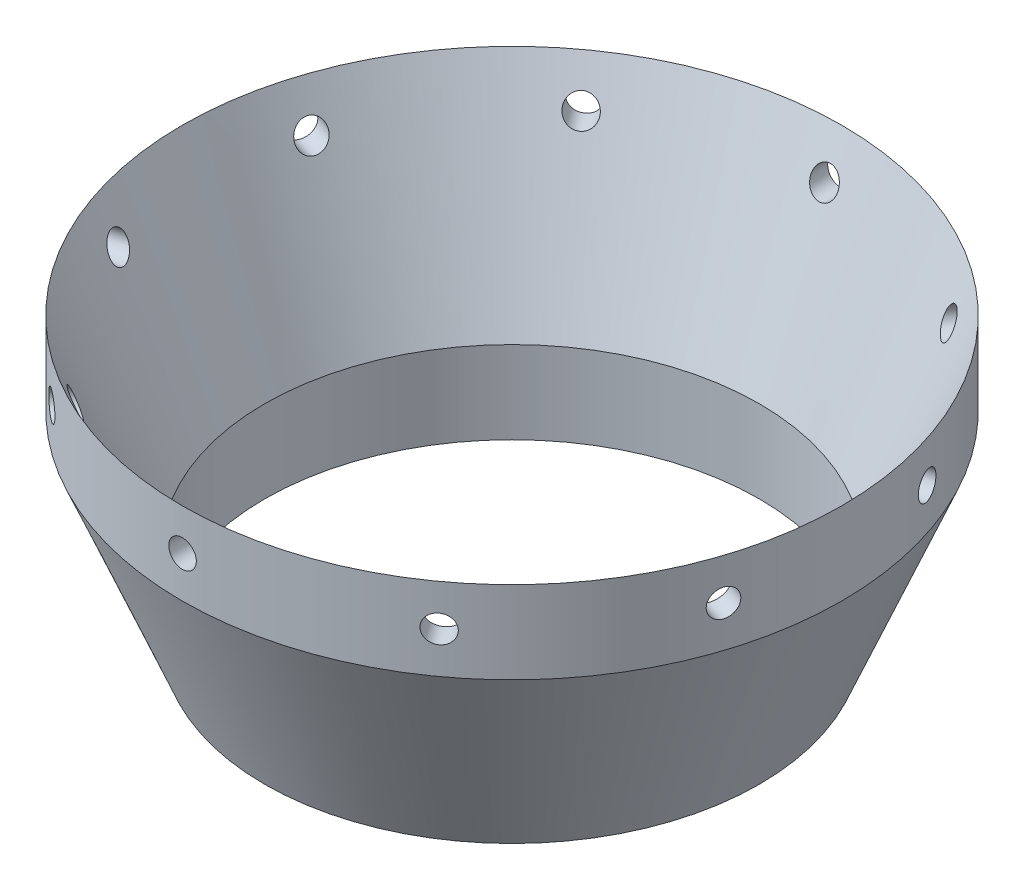
from build123d import *

# Parameters (mm, degrees)
SKETCH2_R          = 3.175
CUT_EXTRUDE1_DEPTH = 267.514272105
CIRPATTERN1_COUNT  = 10


with BuildPart() as part:
    # Sketch1 → Revolve1 (revolve)
    with BuildSketch(Plane.XY):
        Polygon((-57.15, 178.477978871), (-57.15, 197.527978871), (-76.2, 243.755978871), (-76.2, 224.705978871), align=None)
    revolve(axis=Axis((0, 0, 0), (0, 1, 0)))

    # Sketch2 → Cut-Extrude1 (cut, through all)
    with BuildSketch(Plane.XY):
        with Locations((0, 234.230978871)):
            Circle(SKETCH2_R)
    cut_extrude1 = extrude(amount=-CUT_EXTRUDE1_DEPTH, mode=Mode.SUBTRACT)

    # CirPattern1: Cut-Extrude1 ×10 about axis
    cirpattern1_axis = Axis((0, 235.80346447, 0), (0, -1, 0))
    for i in range(1, CIRPATTERN1_COUNT):
        add(cut_extrude1.rotate(cirpattern1_axis, i * 360 / CIRPATTERN1_COUNT), mode=Mode.SUBTRACT)


solid = part.part
